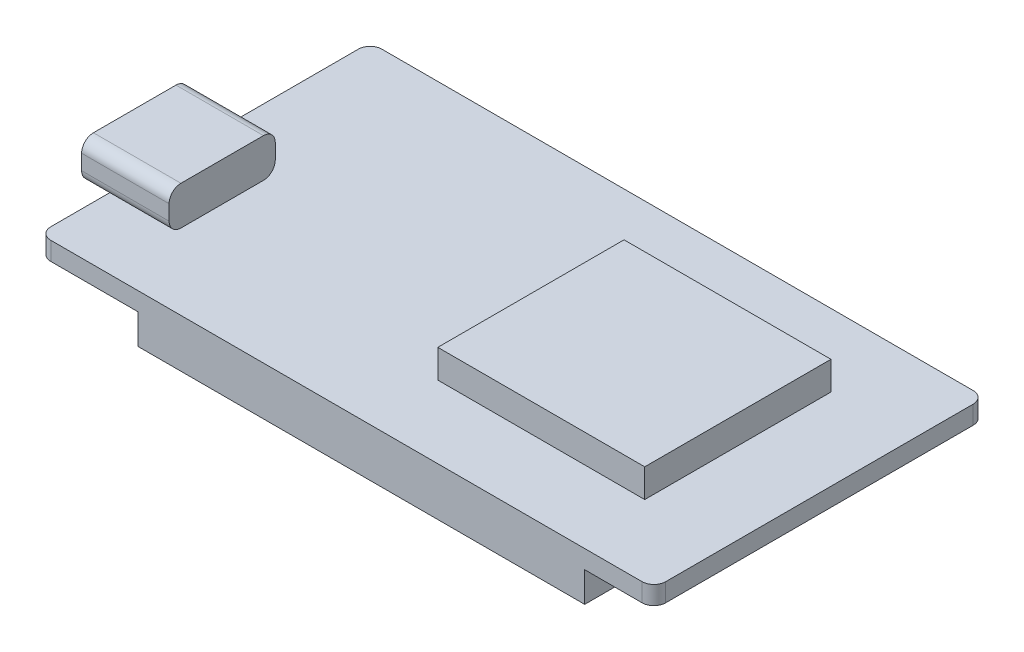
from build123d import *

# Parameters (mm, degrees)
SKETCH_1_W           = 52
SKETCH_1_H           = 28
EXTRUDE_1_DEPTH      = 1.55
FILLET_1_R           = 1
SKETCH_2_W           = 37.76
SKETCH_2_H           = 2.54
EXTRUDE_2_DEPTH      = 2.54
SKETCH_3_W           = 17.5
SKETCH_3_H           = 15.75
EXTRUDE_4_DEPTH      = 2.4
EXTRUDE_6_DEPTH      = 1.8
EXTRUDE_6_DEPTH_BACK = 5.6


with BuildPart() as part:
    # 草圖1 → 填料-伸長1 (new body)
    with BuildSketch(Plane(origin=(0, 0, 0), x_dir=(1, 0, 0), z_dir=(0, 1, 0))):
        Rectangle(SKETCH_1_W, SKETCH_1_H)
    extrude(amount=EXTRUDE_1_DEPTH)

    # 圓角1
    fillet_1_edges = [part.edges().sort_by_distance(p)[0] for p in [
        (26, 0.775, -14),
        (-26, 0.775, -14),
        (-26, 0.775, 14),
        (26, 0.775, 14),
    ]]
    fillet(fillet_1_edges, radius=FILLET_1_R)

    # 草圖2 → 填料-伸長2 (add)
    with BuildSketch(Plane.XZ):
        with Locations((1.27, 12.73)):
            Rectangle(SKETCH_2_W, SKETCH_2_H)
        with Locations((1.27, -12.73)):
            Rectangle(SKETCH_2_W, SKETCH_2_H)
    extrude(amount=EXTRUDE_2_DEPTH)

    # 草圖3 → 填料-伸長4 (add)
    with BuildSketch(Plane(origin=(0, 1.55, 0), x_dir=(1, 0, 0), z_dir=(0, 1, 0))):
        with Locations((10.35, 0)):
            Rectangle(SKETCH_3_W, SKETCH_3_H)
    extrude(amount=EXTRUDE_4_DEPTH)

    # 草圖5 → 填料-伸長6 (add, two sides: drawn at the far end of the back side and taken through both)
    with BuildSketch(Plane.ZY.offset(26).offset(-EXTRUDE_6_DEPTH_BACK)):
        with BuildLine():
            Line((7.6, 1.55), (0.62, 1.55))
            ThreePointArc((0.62, 1.55), (-0.087106781, 1.842893219), (-0.38, 2.55))
            Line((-0.38, 2.55), (-0.38, 3.83))
            ThreePointArc((-0.38, 3.83), (-0.087106781, 4.537106781), (0.62, 4.83))
            Line((0.62, 4.83), (7.6, 4.83))
            ThreePointArc((7.6, 4.83), (8.307106781, 4.537106781), (8.6, 3.83))
            Line((8.6, 3.83), (8.6, 2.55))
            ThreePointArc((8.6, 2.55), (8.307106781, 1.842893219), (7.6, 1.55))
        make_face()
    extrude(amount=EXTRUDE_6_DEPTH + EXTRUDE_6_DEPTH_BACK)


solid = part.part
